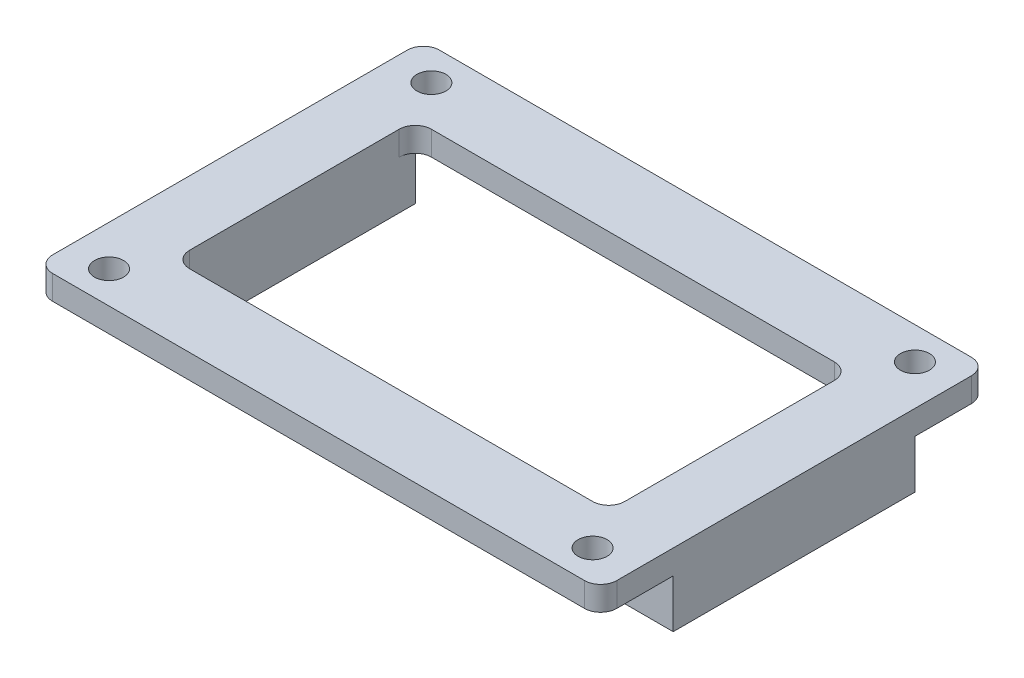
from build123d import *

# Parameters (mm, degrees)
SKETCH1_W                = 70
SKETCH1_H                = 48
SKETCH1_W_2              = 60
SKETCH1_H_2              = 40
BOSS_EXTRUDE1_DEPTH      = 3
M3_CLEARANCE_HOLE1_D     = 3.6
M3_CLEARANCE_HOLE1_DEPTH = 9
M3_CLEARANCE_HOLE1_TIP   = 1.081549114
SKETCH6_W                = 8
SKETCH6_H                = 30
BOSS_EXTRUDE2_DEPTH      = 6
SKETCH7_W                = 54
SKETCH7_H                = 30
CUT_EXTRUDE1_DEPTH       = 43.860237983
FILLET1_R                = 2


# Read off the part's stored shape, not the designer's step: Ø1.0mm Dowel Hole1
with BuildPart() as part:
    # Sketch1 → Boss-Extrude1 (new body)
    # profile 1 of 2: a face of its own
    with BuildSketch(Plane(origin=(0, 0, 0), x_dir=(1, 0, 0), z_dir=(0, 1, 0))):
        Rectangle(SKETCH1_W, SKETCH1_H)
        Rectangle(SKETCH1_W_2, SKETCH1_H_2, mode=Mode.SUBTRACT)
    # profile 2 of 2: a face of its own
    with BuildSketch(Plane(origin=(0, 0, 0), x_dir=(1, 0, 0), z_dir=(0, 1, 0))):
        Rectangle(SKETCH1_W_2, SKETCH1_H_2)
    extrude(amount=BOSS_EXTRUDE1_DEPTH)

    # M3 Clearance Hole1
    with Locations(Plane(origin=(0, 0, 0), x_dir=(-1, 0, 0), z_dir=(0, -1, 0))):
        with Locations((30, -20), (30, 20), (-30, 20), (-30, -20)):
            Hole(M3_CLEARANCE_HOLE1_D / 2, depth=M3_CLEARANCE_HOLE1_DEPTH)
            with Locations((0, 0, -(M3_CLEARANCE_HOLE1_DEPTH + M3_CLEARANCE_HOLE1_TIP / 2))):  # 118° drill point
                Cone(0, M3_CLEARANCE_HOLE1_D / 2, M3_CLEARANCE_HOLE1_TIP, mode=Mode.SUBTRACT)

    # Sketch6 → Boss-Extrude2 (add)
    with BuildSketch(Plane.XZ):
        with Locations((-31, 0)):
            Rectangle(SKETCH6_W, SKETCH6_H)
        with Locations((31, 0)):
            Rectangle(SKETCH6_W, SKETCH6_H)
    extrude(amount=BOSS_EXTRUDE2_DEPTH)

    # Ø1.0mm Dowel Hole1 outline → Ø1.0mm Dowel Hole1 (revolve, cut)
    with BuildSketch(Plane(origin=(-32.5, 0, -12.5), x_dir=(1, 0, 0), z_dir=(0, 0, 1))):
        Polygon((1.8, 0), (0, 1.081549114), (0, -6), (1.8, -6), align=None)
    revolve(axis=Axis((-32.5, 0, -12.5), (0, 1, 0)), mode=Mode.SUBTRACT)

    # 1.0mm Dowel Hole1 2 outline → 1.0mm Dowel Hole1 2 (revolve, cut)
    with BuildSketch(Plane(origin=(32.5, 0, 12.5), x_dir=(1, 0, 0), z_dir=(0, 0, 1))):
        Polygon((1.8, 0), (0, 1.081549114), (0, -6), (1.8, -6), align=None)
    revolve(axis=Axis((32.5, 0, 12.5), (0, 1, 0)), mode=Mode.SUBTRACT)

    # 1.0mm Dowel Hole1 3 outline → 1.0mm Dowel Hole1 3 (revolve, cut)
    with BuildSketch(Plane(origin=(32.5, 0, -12.5), x_dir=(1, 0, 0), z_dir=(0, 0, 1))):
        Polygon((1.8, 0), (0, 1.081549114), (0, -6), (1.8, -6), align=None)
    revolve(axis=Axis((32.5, 0, -12.5), (0, 1, 0)), mode=Mode.SUBTRACT)

    # 1.0mm Dowel Hole1 4 outline → 1.0mm Dowel Hole1 4 (revolve, cut)
    with BuildSketch(Plane(origin=(-32.5, 0, 12.5), x_dir=(1, 0, 0), z_dir=(0, 0, 1))):
        Polygon((1.8, 0), (0, 1.081549114), (0, -6), (1.8, -6), align=None)
    revolve(axis=Axis((-32.5, 0, 12.5), (0, 1, 0)), mode=Mode.SUBTRACT)

    # 1.0mm Dowel Hole1 5 outline → 1.0mm Dowel Hole1 5 (revolve, cut)
    with BuildSketch(Plane.XY):
        Polygon((1.8, 0), (0, 1.081549114), (0, 0), align=None)
    revolve(axis=Axis((0, 0, 0), (0, 1, 0)), mode=Mode.SUBTRACT)

    # Sketch7 → Cut-Extrude1 (cut, through all)
    with BuildSketch(Plane.XZ):
        Rectangle(SKETCH7_W, SKETCH7_H)
    extrude(amount=-CUT_EXTRUDE1_DEPTH, mode=Mode.SUBTRACT)

    # Fillet1
    fillet1_edges = [part.edges().sort_by_distance(p)[0] for p in [
        (-27, 1.5, -15),
        (-27, 1.5, 15),
        (27, 1.5, 15),
        (27, 1.5, -15),
        (-35, 1.5, -24),
        (35, 1.5, -24),
        (35, 1.5, 24),
        (-35, 1.5, 24),
    ]]
    fillet(fillet1_edges, radius=FILLET1_R)


solid = part.part
